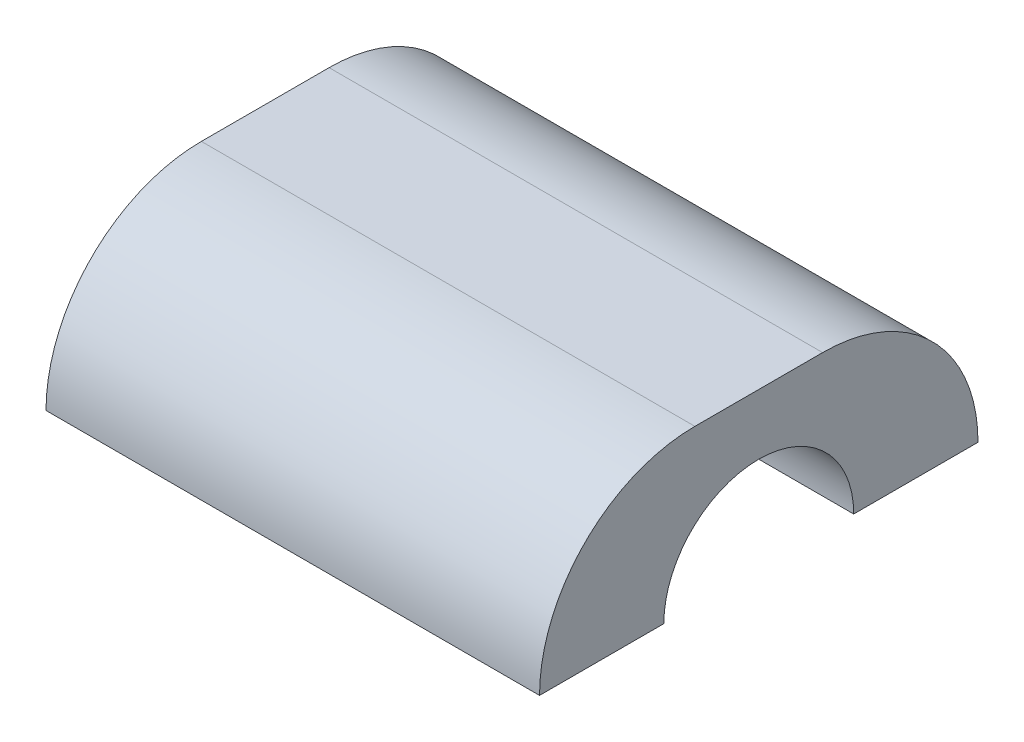
from build123d import *

# Parameters (mm, degrees)
SKETCH1_W           = 57.18
SKETCH1_H           = 50.8
BOSS_EXTRUDE1_DEPTH = 18
SKETCH2_R           = 11
CUT_EXTRUDE1_DEPTH  = 58
FILLET2_R           = 18
FILLET3_R           = 18


with BuildPart() as part:
    # Sketch1 → Boss-Extrude1 (new body)
    with BuildSketch(Plane(origin=(0, 0, 0), x_dir=(1, 0, 0), z_dir=(0, 1, 0))):
        with Locations((-6.481243802, 7.033465199)):
            Rectangle(SKETCH1_W, SKETCH1_H)
    extrude(amount=BOSS_EXTRUDE1_DEPTH)

    # Sketch2 → Cut-Extrude1 (cut)
    with BuildSketch(Plane.ZY.offset(35.071243802)):
        with Locations((-7.033465199, 0)):
            Circle(SKETCH2_R)
    extrude(amount=-CUT_EXTRUDE1_DEPTH, mode=Mode.SUBTRACT)

    # Fillet2
    fillet2_edges = [part.edges().sort_by_distance(p)[0] for p in [
        (-6.481243802, 18, 18.366534801),
    ]]
    fillet(fillet2_edges, radius=FILLET2_R - 0.0001)  # a hair under: the kernel refuses the full size

    # Fillet3
    fillet3_edges = [part.edges().sort_by_distance(p)[0] for p in [
        (-6.481243802, 18, -32.433465199),
    ]]
    fillet(fillet3_edges, radius=FILLET3_R - 0.0001)  # a hair under: the kernel refuses the full size


solid = part.part
